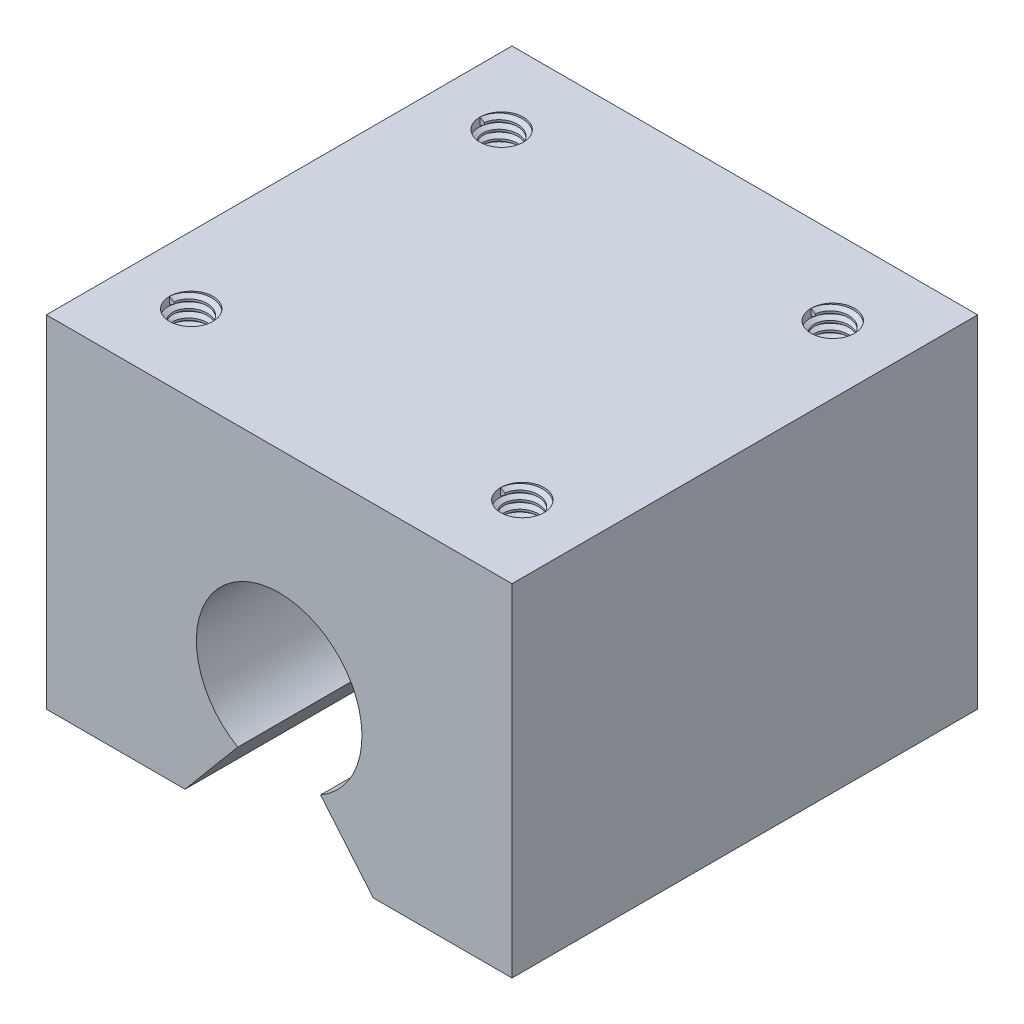
from build123d import *

# Parameters (mm, degrees)
BOSS_EXTRUDE1_DEPTH             = 45
TAP_DRILL_FOR_M5X0_8_TAP1_D     = 4.2
TAP_DRILL_FOR_M5X0_8_TAP1_DEPTH = 12
TAP_DRILL_FOR_M5X0_8_TAP1_TIP   = 1.2618073
THREAD1_PITCH                   = 0.8
THREAD2_PITCH                   = 0.8
THREAD3_PITCH                   = 0.8
THREAD4_PITCH                   = 0.8


with BuildPart() as part:
    # Sketch1 → Boss-Extrude1 (new body)
    with BuildSketch(Plane.XY):
        with BuildLine():
            Line((32.068965517, 0), (32.068965517, 33))
            Line((32.068965517, 33), (-12.931034483, 33))
            Line((-12.931034483, 33), (-12.931034483, 0))
            Line((-12.931034483, 0), (0.474123087, 0))
            Line((0.474123087, 0), (5.568965517, 6.07179677))
            ThreePointArc((5.568965517, 6.07179677), (9.568965517, 21), (13.568965517, 6.07179677))
            Line((13.568965517, 6.07179677), (18.663807947, 0))
            Line((18.663807947, 0), (32.068965517, 0))
        make_face()
    extrude(amount=BOSS_EXTRUDE1_DEPTH)

    # Tap Drill for M5x0.8 Tap1
    with Locations(Plane(origin=(0, 33, 0), x_dir=(1, 0, 0), z_dir=(0, 1, 0))):
        with Locations((-6.431034483, -7.5), (25.568965517, -7.5), (25.568965517, -37.5), (-6.431034483, -37.5)):
            Hole(TAP_DRILL_FOR_M5X0_8_TAP1_D / 2, depth=TAP_DRILL_FOR_M5X0_8_TAP1_DEPTH)
            with Locations((0, 0, -(TAP_DRILL_FOR_M5X0_8_TAP1_DEPTH + TAP_DRILL_FOR_M5X0_8_TAP1_TIP / 2))):  # 118° drill point
                Cone(0, TAP_DRILL_FOR_M5X0_8_TAP1_D / 2, TAP_DRILL_FOR_M5X0_8_TAP1_TIP, mode=Mode.SUBTRACT)

    # Thread1: arcs per turn and ends read off the stored shape
    # Thread1: the profile of Thread Profile1 profile screwed along a right-hand helix through 15 turns, 8 arcs to a turn; built about Z, then put on its axis
    thread1_z = Axis((0, 0, 0), (0, 0, 1))
    thread1_corners = [(2.1003, 0, -0.000173205), (2.1003, 0, 0.700173203), (1.6669873, 0, 0.449999999), (1.6669873, 0, 0.249999999)]
    with BuildLine(mode=Mode.PRIVATE) as thread1_profile:
        Line(thread1_corners[0], thread1_corners[1])
        Line(thread1_corners[1], thread1_corners[2])
        Line(thread1_corners[2], thread1_corners[3])
        Line(thread1_corners[3], thread1_corners[0])
    thread1_cap = Face(thread1_profile.wire())
    thread1_turn_angles = [0, 22.5, 45, 67.5, 90, 112.5, 135, 157.5, 180, 202.5, 225, 247.5, 270, 292.5, 315, 337.5, 360]
    thread1_turn_weights = [1, 0.9238795325112867, 1, 0.9238795325112867, 1, 0.9238795325112867, 1, 0.9238795325112867, 1, 0.9238795325112867, 1, 0.9238795325112867, 1, 0.9238795325112867, 1, 0.9238795325112867, 1]
    thread1_turn_rails = [Edge.make_bspline([Vector(p[0], p[1], 0).rotate(thread1_z, thread1_turn_angles[k]) / thread1_turn_weights[k] + Vector(0, 0, p[2] + THREAD1_PITCH * thread1_turn_angles[k] / 360) for k in range(17)], [0, 0, 0, 1, 1, 2, 2, 3, 3, 4, 4, 5, 5, 6, 6, 7, 7, 8, 8, 8], 2, thread1_turn_weights) for p in thread1_corners]
    thread1_turn_sides = [Face.make_surface_from_curves(thread1_turn_rails[p[0]], thread1_turn_rails[p[1]]) for p in [(0, 1), (1, 2), (2, 3), (3, 0)]]
    thread1 = Plane(origin=(25.568965517, 33, 37.5), x_dir=(-1, 0, 0), z_dir=(0, -1, 0)) * Solid(Shell([*[p.moved(Location((0, 0, THREAD1_PITCH * i))) for i in range(15) for p in thread1_turn_sides], thread1_cap, thread1_cap.rotate(thread1_z, 5400).moved(Location((0, 0, THREAD1_PITCH * 5400 / 360)))]))
    add(thread1)

    # Thread2: arcs per turn and ends read off the stored shape
    # Thread2: the profile of Thread Profile2 profile screwed along a right-hand helix through 15 turns, 8 arcs to a turn; built about Z, then put on its axis
    thread2_z = Axis((0, 0, 0), (0, 0, 1))
    thread2_corners = [(2.1003, 0, -0.000173205), (2.1003, 0, 0.700173203), (1.6669873, 0, 0.449999999), (1.6669873, 0, 0.249999999)]
    with BuildLine(mode=Mode.PRIVATE) as thread2_profile:
        Line(thread2_corners[0], thread2_corners[1])
        Line(thread2_corners[1], thread2_corners[2])
        Line(thread2_corners[2], thread2_corners[3])
        Line(thread2_corners[3], thread2_corners[0])
    thread2_cap = Face(thread2_profile.wire())
    thread2_turn_angles = [0, 22.5, 45, 67.5, 90, 112.5, 135, 157.5, 180, 202.5, 225, 247.5, 270, 292.5, 315, 337.5, 360]
    thread2_turn_weights = [1, 0.9238795325112867, 1, 0.9238795325112867, 1, 0.9238795325112867, 1, 0.9238795325112867, 1, 0.9238795325112867, 1, 0.9238795325112867, 1, 0.9238795325112867, 1, 0.9238795325112867, 1]
    thread2_turn_rails = [Edge.make_bspline([Vector(p[0], p[1], 0).rotate(thread2_z, thread2_turn_angles[k]) / thread2_turn_weights[k] + Vector(0, 0, p[2] + THREAD2_PITCH * thread2_turn_angles[k] / 360) for k in range(17)], [0, 0, 0, 1, 1, 2, 2, 3, 3, 4, 4, 5, 5, 6, 6, 7, 7, 8, 8, 8], 2, thread2_turn_weights) for p in thread2_corners]
    thread2_turn_sides = [Face.make_surface_from_curves(thread2_turn_rails[p[0]], thread2_turn_rails[p[1]]) for p in [(0, 1), (1, 2), (2, 3), (3, 0)]]
    thread2 = Plane(origin=(-6.431034483, 33, 37.5), x_dir=(-1, 0, 0), z_dir=(0, -1, 0)) * Solid(Shell([*[p.moved(Location((0, 0, THREAD2_PITCH * i))) for i in range(15) for p in thread2_turn_sides], thread2_cap, thread2_cap.rotate(thread2_z, 5400).moved(Location((0, 0, THREAD2_PITCH * 5400 / 360)))]))
    add(thread2)

    # Thread3: arcs per turn and ends read off the stored shape
    # Thread3: the profile of Thread Profile3 profile screwed along a right-hand helix through 15 turns, 8 arcs to a turn; built about Z, then put on its axis
    thread3_z = Axis((0, 0, 0), (0, 0, 1))
    thread3_corners = [(2.1003, 0, -0.000173205), (2.1003, 0, 0.700173203), (1.6669873, 0, 0.449999999), (1.6669873, 0, 0.249999999)]
    with BuildLine(mode=Mode.PRIVATE) as thread3_profile:
        Line(thread3_corners[0], thread3_corners[1])
        Line(thread3_corners[1], thread3_corners[2])
        Line(thread3_corners[2], thread3_corners[3])
        Line(thread3_corners[3], thread3_corners[0])
    thread3_cap = Face(thread3_profile.wire())
    thread3_turn_angles = [0, 22.5, 45, 67.5, 90, 112.5, 135, 157.5, 180, 202.5, 225, 247.5, 270, 292.5, 315, 337.5, 360]
    thread3_turn_weights = [1, 0.9238795325112867, 1, 0.9238795325112867, 1, 0.9238795325112867, 1, 0.9238795325112867, 1, 0.9238795325112867, 1, 0.9238795325112867, 1, 0.9238795325112867, 1, 0.9238795325112867, 1]
    thread3_turn_rails = [Edge.make_bspline([Vector(p[0], p[1], 0).rotate(thread3_z, thread3_turn_angles[k]) / thread3_turn_weights[k] + Vector(0, 0, p[2] + THREAD3_PITCH * thread3_turn_angles[k] / 360) for k in range(17)], [0, 0, 0, 1, 1, 2, 2, 3, 3, 4, 4, 5, 5, 6, 6, 7, 7, 8, 8, 8], 2, thread3_turn_weights) for p in thread3_corners]
    thread3_turn_sides = [Face.make_surface_from_curves(thread3_turn_rails[p[0]], thread3_turn_rails[p[1]]) for p in [(0, 1), (1, 2), (2, 3), (3, 0)]]
    thread3 = Plane(origin=(25.568965517, 33, 7.5), x_dir=(-1, 0, 0), z_dir=(0, -1, 0)) * Solid(Shell([*[p.moved(Location((0, 0, THREAD3_PITCH * i))) for i in range(15) for p in thread3_turn_sides], thread3_cap, thread3_cap.rotate(thread3_z, 5400).moved(Location((0, 0, THREAD3_PITCH * 5400 / 360)))]))
    add(thread3)

    # Thread4: arcs per turn and ends read off the stored shape
    # Thread4: the profile of Thread Profile4 profile screwed along a right-hand helix through 15 turns, 8 arcs to a turn; built about Z, then put on its axis
    thread4_z = Axis((0, 0, 0), (0, 0, 1))
    thread4_corners = [(2.1003, 0, -0.000173205), (2.1003, 0, 0.700173203), (1.6669873, 0, 0.449999999), (1.6669873, 0, 0.249999999)]
    with BuildLine(mode=Mode.PRIVATE) as thread4_profile:
        Line(thread4_corners[0], thread4_corners[1])
        Line(thread4_corners[1], thread4_corners[2])
        Line(thread4_corners[2], thread4_corners[3])
        Line(thread4_corners[3], thread4_corners[0])
    thread4_cap = Face(thread4_profile.wire())
    thread4_turn_angles = [0, 22.5, 45, 67.5, 90, 112.5, 135, 157.5, 180, 202.5, 225, 247.5, 270, 292.5, 315, 337.5, 360]
    thread4_turn_weights = [1, 0.9238795325112867, 1, 0.9238795325112867, 1, 0.9238795325112867, 1, 0.9238795325112867, 1, 0.9238795325112867, 1, 0.9238795325112867, 1, 0.9238795325112867, 1, 0.9238795325112867, 1]
    thread4_turn_rails = [Edge.make_bspline([Vector(p[0], p[1], 0).rotate(thread4_z, thread4_turn_angles[k]) / thread4_turn_weights[k] + Vector(0, 0, p[2] + THREAD4_PITCH * thread4_turn_angles[k] / 360) for k in range(17)], [0, 0, 0, 1, 1, 2, 2, 3, 3, 4, 4, 5, 5, 6, 6, 7, 7, 8, 8, 8], 2, thread4_turn_weights) for p in thread4_corners]
    thread4_turn_sides = [Face.make_surface_from_curves(thread4_turn_rails[p[0]], thread4_turn_rails[p[1]]) for p in [(0, 1), (1, 2), (2, 3), (3, 0)]]
    thread4 = Plane(origin=(-6.431034483, 33, 7.5), x_dir=(-1, 0, 0), z_dir=(0, -1, 0)) * Solid(Shell([*[p.moved(Location((0, 0, THREAD4_PITCH * i))) for i in range(15) for p in thread4_turn_sides], thread4_cap, thread4_cap.rotate(thread4_z, 5400).moved(Location((0, 0, THREAD4_PITCH * 5400 / 360)))]))
    add(thread4)


solid = part.part
